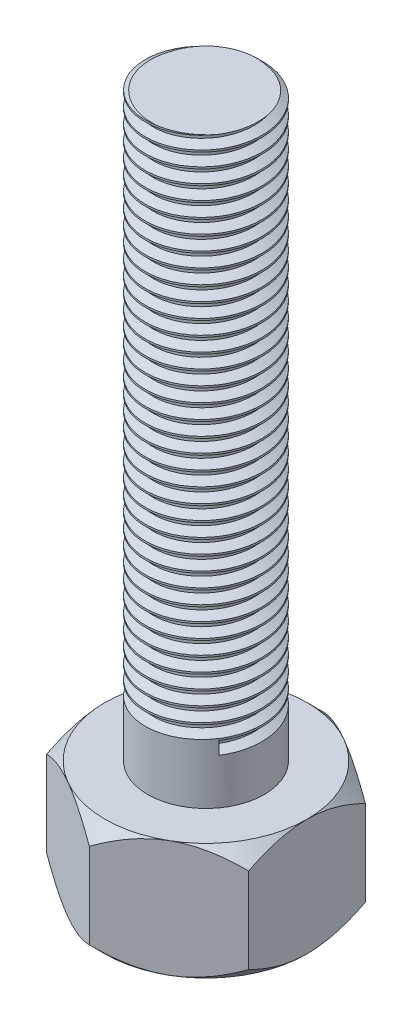
from build123d import *

# Parameters (mm, degrees)
BOSS_EXTRUDE1_DEPTH     = 5
SKETCH3_OUTSIDE_W       = 44.976
SKETCH3_OUTSIDE_H       = 47.656
SKETCH3_OUTSIDE_R       = 8.660254038
CUT_EXTRUDE2_DEPTH      = 10
CUT_EXTRUDE2_DRAFT      = -45
MIRROR1_COPY_1_SKETCH_W = 44.976
MIRROR1_COPY_1_SKETCH_H = 47.656
MIRROR1_COPY_1_SKETCH_R = 8.660254038
MIRROR1_COPY_1_DEPTH    = 10
MIRROR1_COPY_1_DRAFT    = -45
SKETCH4_R               = 5
BOSS_EXTRUDE2_DEPTH     = 50
THREAD1_PITCH           = 1.25


with BuildPart() as part:
    # Sketch1 → Boss-Extrude1 (new, symmetric)
    with BuildSketch(Plane(origin=(0, 0, 0), x_dir=(1, 0, 0), z_dir=(0, 1, 0))):
        Polygon((8.660254038, -5), (8.660254038, 5), (0, 10), (-8.660254038, 5), (-8.660254038, -5), (0, -10), align=None)
    extrude(amount=BOSS_EXTRUDE1_DEPTH, both=True)


with BuildPart() as cut_extrude2_tool:
    # Sketch3 outside → Cut-Extrude2 (with draft: the straight prism first)
    with BuildSketch(Plane.XZ.offset(5)):
        Rectangle(SKETCH3_OUTSIDE_W, SKETCH3_OUTSIDE_H)
        Circle(SKETCH3_OUTSIDE_R, mode=Mode.SUBTRACT)
    extrude(amount=-CUT_EXTRUDE2_DEPTH)
    # Cut-Extrude2: the draft: its side faces are tilted about the plane it starts from
    cut_extrude2_sides = [cut_extrude2_tool.faces().sort_by_distance(p)[0] for p in [
        (0, 0, -23.828),
        (22.488, 0, 0),
        (0, 0, 23.828),
        (-22.488, 0, 0),
        (-8.660254038, 0, 0),
    ]]
    draft(cut_extrude2_sides, Plane.XZ.offset(5), CUT_EXTRUDE2_DRAFT)


with BuildPart() as part_1:
    add(part.part)

    # Cut-Extrude2: cut by cut_extrude2_tool
    add(cut_extrude2_tool.part, mode=Mode.SUBTRACT)


with BuildPart() as mirror1_copy_1_tool:
    # Mirror1 copy 1 sketch → Mirror1 copy 1 (with draft: the straight prism first)
    with BuildSketch(Plane(origin=(0, 5, 0), x_dir=(1, 0, 0), z_dir=(0, 1, 0))):
        Rectangle(MIRROR1_COPY_1_SKETCH_W, MIRROR1_COPY_1_SKETCH_H)
        Circle(MIRROR1_COPY_1_SKETCH_R, mode=Mode.SUBTRACT)
    extrude(amount=-MIRROR1_COPY_1_DEPTH)
    # Mirror1 copy 1: the draft: its side faces are tilted about the plane it starts from
    mirror1_copy_1_sides = [mirror1_copy_1_tool.faces().sort_by_distance(p)[0] for p in [
        (0, 0, -23.828),
        (22.488, 0, 0),
        (0, 0, 23.828),
        (-22.488, 0, 0),
        (-8.660254038, 0, 0),
    ]]
    draft(mirror1_copy_1_sides, Plane(origin=(0, 5, 0), x_dir=(1, 0, 0), z_dir=(0, 1, 0)), MIRROR1_COPY_1_DRAFT)


with BuildPart() as part_2:
    add(part_1.part)

    # Mirror1 copy 1: cut by mirror1_copy_1_tool
    add(mirror1_copy_1_tool.part, mode=Mode.SUBTRACT)

    # Sketch4 → Boss-Extrude2 (add)
    with BuildSketch(Plane(origin=(0, 5, 0), x_dir=(1, 0, 0), z_dir=(0, 1, 0))):
        with Locations(Location((0, 0, 0), (0, 0, 270))):
            Circle(SKETCH4_R)
    extrude(amount=BOSS_EXTRUDE2_DEPTH)

    # Thread1: the profile of Thread Profile1 profile screwed along a right-hand helix of 37.6 turns, 8 arcs to a turn; built about Z, then put on its axis
    thread1_z = Axis((0, 0, 0), (0, 0, 1))
    thread1_corners = [(5.0003, 0, -0.000173205), (5.0003, 0, 1.093923202), (4.323417656, 0, 0.703124998), (4.323417656, 0, 0.390624998)]
    with BuildLine(mode=Mode.PRIVATE) as thread1_profile:
        Line(thread1_corners[0], thread1_corners[1])
        Line(thread1_corners[1], thread1_corners[2])
        Line(thread1_corners[2], thread1_corners[3])
        Line(thread1_corners[3], thread1_corners[0])
    thread1_cap = Face(thread1_profile.wire())
    thread1_turn_angles = [0, 22.5, 45, 67.5, 90, 112.5, 135, 157.5, 180, 202.5, 225, 247.5, 270, 292.5, 315, 337.5, 360]
    thread1_turn_weights = [1, 0.9238795325112867, 1, 0.9238795325112867, 1, 0.9238795325112867, 1, 0.9238795325112867, 1, 0.9238795325112867, 1, 0.9238795325112867, 1, 0.9238795325112867, 1, 0.9238795325112867, 1]
    thread1_turn_rails = [Edge.make_bspline([Vector(p[0], p[1], 0).rotate(thread1_z, thread1_turn_angles[k]) / thread1_turn_weights[k] + Vector(0, 0, p[2] + THREAD1_PITCH * thread1_turn_angles[k] / 360) for k in range(17)], [0, 0, 0, 1, 1, 2, 2, 3, 3, 4, 4, 5, 5, 6, 6, 7, 7, 8, 8, 8], 2, thread1_turn_weights) for p in thread1_corners]
    thread1_turn_sides = [Face.make_surface_from_curves(thread1_turn_rails[p[0]], thread1_turn_rails[p[1]]) for p in [(0, 1), (1, 2), (2, 3), (3, 0)]]
    thread1_turn = Solid(Shell([*thread1_turn_sides, thread1_cap, thread1_cap.rotate(thread1_z, 360).moved(Location((0, 0, THREAD1_PITCH * 360 / 360)))]))
    thread1_last_angles = [13320, 13342.5, 13365, 13387.5, 13410, 13432.5, 13455, 13477.5, 13500, 13518, 13536]
    thread1_last_weights = [1, 0.9238795325112867, 1, 0.9238795325112867, 1, 0.9238795325112867, 1, 0.9238795325112867, 1, 0.9510565162951535, 1]
    thread1_last_rails = [Edge.make_bspline([Vector(p[0], p[1], 0).rotate(thread1_z, thread1_last_angles[k]) / thread1_last_weights[k] + Vector(0, 0, p[2] + THREAD1_PITCH * thread1_last_angles[k] / 360) for k in range(11)], [0, 0, 0, 1, 1, 2, 2, 3, 3, 4, 4, 5, 5, 5], 2, thread1_last_weights) for p in thread1_corners]
    thread1_last_sides = [Face.make_surface_from_curves(thread1_last_rails[p[0]], thread1_last_rails[p[1]]) for p in [(0, 1), (1, 2), (2, 3), (3, 0)]]
    thread1_last = Solid(Shell([*thread1_last_sides, thread1_cap.rotate(thread1_z, 13320).moved(Location((0, 0, THREAD1_PITCH * 13320 / 360))), thread1_cap.rotate(thread1_z, 13536).moved(Location((0, 0, THREAD1_PITCH * 13536 / 360)))]))
    thread1_each = [*[thread1_turn.moved(Location((0, 0, THREAD1_PITCH * i))) for i in range(37)], thread1_last]
    add(Plane(origin=(0, 57, 0), x_dir=(-1, 0, 0), z_dir=(0, -1, 0)) * Compound([thread1_each[i] for i in range(0, 38, 2)]), mode=Mode.SUBTRACT)
    add(Plane(origin=(0, 57, 0), x_dir=(-1, 0, 0), z_dir=(0, -1, 0)) * Compound([thread1_each[i] for i in range(1, 38, 2)]), mode=Mode.SUBTRACT)


solid = part_2.part
